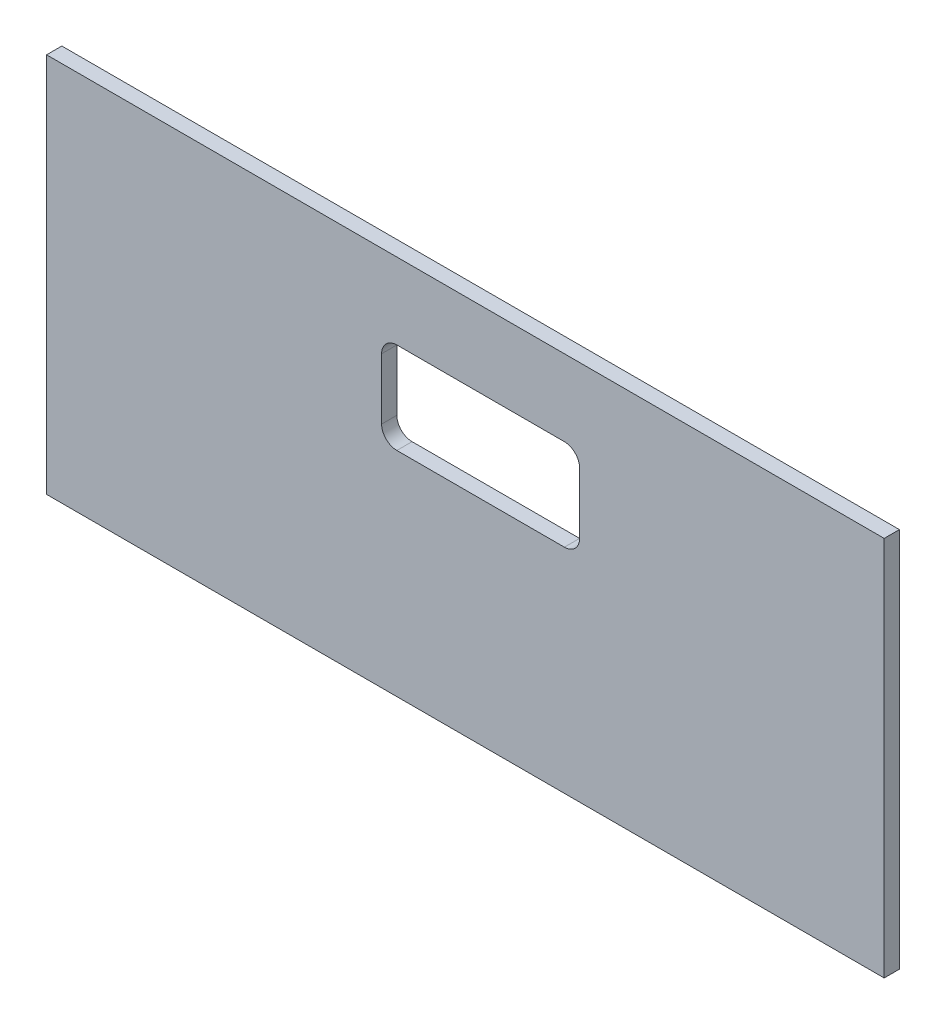
from build123d import *

# Parameters (mm, degrees)
SKETCH1_W               = 55
SKETCH1_H               = 25
BOSS_EXTRUDE1_DEPTH     = 1
CUT_EXTRUDE1_DEPTH      = 31.224162519
CUT_EXTRUDE1_DEPTH_BACK = 31.224162519
SKETCH2_W               = 13
SKETCH2_H               = 6
FILLET1_R               = 1


with BuildPart() as part:
    # Sketch1 → Boss-Extrude1 (new body)
    with BuildSketch(Plane.XY):
        Rectangle(SKETCH1_W, SKETCH1_H)
    extrude(amount=BOSS_EXTRUDE1_DEPTH)

    # Sketch2 → Cut-Extrude1 (cut, two sides: drawn at the far end of the back side and taken through both)
    with BuildSketch(Plane.XY.offset(1).offset(-CUT_EXTRUDE1_DEPTH_BACK)):
        with Locations((1, 4.5)):
            Rectangle(SKETCH2_W, SKETCH2_H)
    extrude(amount=CUT_EXTRUDE1_DEPTH + CUT_EXTRUDE1_DEPTH_BACK, mode=Mode.SUBTRACT)

    # Fillet1
    fillet1_edges = [part.edges().sort_by_distance(p)[0] for p in [
        (-5.5, 1.5, 0.5),
        (7.5, 1.5, 0.5),
        (7.5, 7.5, 0.5),
        (-5.5, 7.5, 0.5),
    ]]
    fillet(fillet1_edges, radius=FILLET1_R)


solid = part.part
